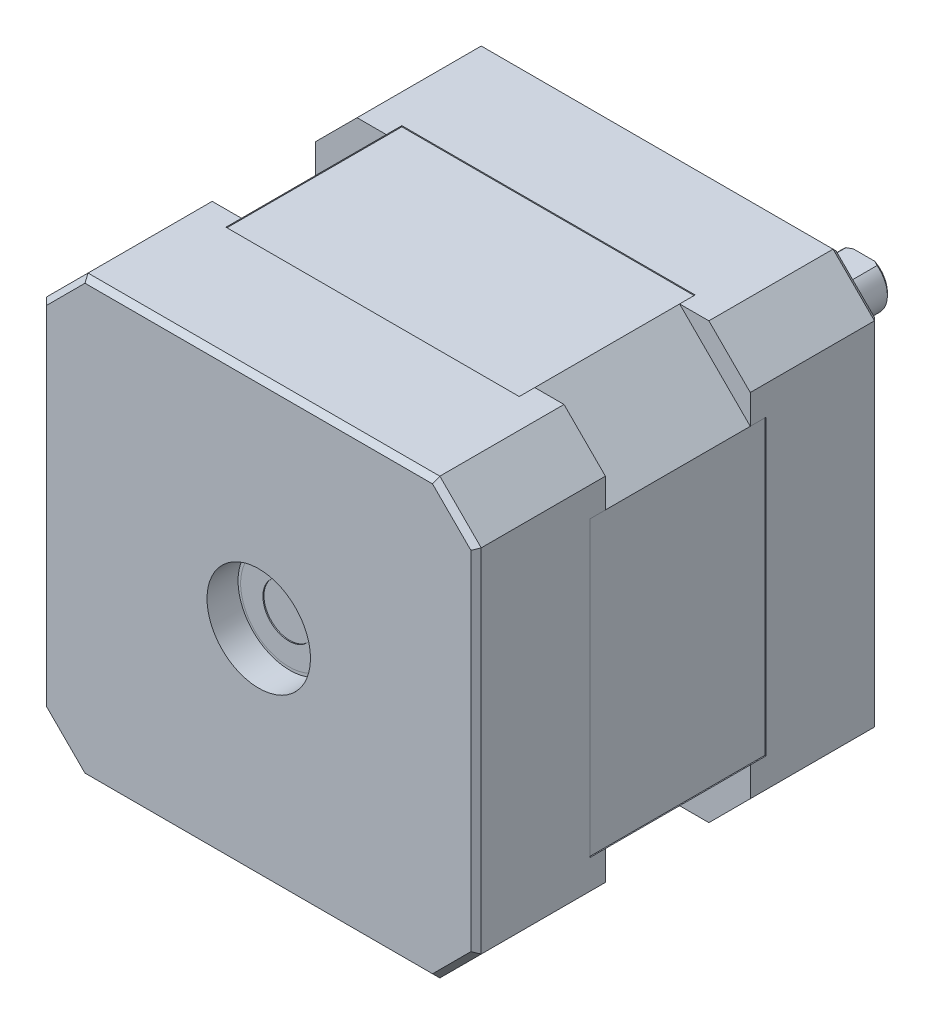
from build123d import *

# Parameters (mm, degrees)
CROQUIS1_W              = 42
CROQUIS1_H              = 42
SALIENTE_EXTRUIR1_DEPTH = 39
CHAFL_N2_SIZE           = 4
CHAFL_N3_SIZE           = 0.5
CROQUIS2_R              = 15
CORTAR_EXTRUIR2_DEPTH   = 0.5
CHAFL_N4_SIZE           = 1
CROQUIS3_R              = 11
CROQUIS3_R_2            = 4.75
SALIENTE_EXTRUIR2_DEPTH = 2.5
CROQUIS4_R              = 2.5
SALIENTE_EXTRUIR3_DEPTH = 20
CHAFL_N5_SIZE           = 0.25
CROQUIS5_W              = 26.553784045
CROQUIS5_H              = 10.322094095
CORTAR_EXTRUIR3_DEPTH   = 17.5
CROQUIS6_R              = 1.5
CORTAR_EXTRUIR4_DEPTH   = 12
MATRIZC1_COUNT          = 4
CROQUIS7_W              = 14
CROQUIS7_H              = 16.933623344
CORTAR_EXTRUIR5_DEPTH   = 2
MATRIZC2_COUNT          = 4
CORTAR_EXTRUIR6_DEPTH   = 0.1
MATRIZC3_COUNT          = 4
CROQUIS9_R              = 5
CORTAR_EXTRUIR7_DEPTH   = 3
SALIENTE_EXTRUIR4_START = 0.1
CROQUIS10_R             = 4.65
CROQUIS10_R_2           = 2.5
SALIENTE_EXTRUIR4_DEPTH = 0.1


with BuildPart() as part:
    # Croquis1 → Saliente-Extruir1 (new body)
    with BuildSketch(Plane.XY):
        Rectangle(CROQUIS1_W, CROQUIS1_H)
    extrude(amount=SALIENTE_EXTRUIR1_DEPTH)

    # Chaflán2
    chafl_n2_edges = [part.edges().sort_by_distance(p)[0] for p in [
        (21, -21, 19.5),
        (-21, -21, 19.5),
        (-21, 21, 19.5),
        (21, 21, 19.5),
    ]]
    chamfer(chafl_n2_edges, length=CHAFL_N2_SIZE)

    # Chaflán3
    chafl_n3_edges = [part.edges().sort_by_distance(p)[0] for p in [
        (21, 0, 0),
        (21, 0, 39),
        (0, -21, 0),
        (-21, 0, 0),
        (0, 21, 0),
        (-19, -19, 0),
        (-19, 19, 0),
        (19, 19, 0),
        (19, -19, 0),
        (0, -21, 39),
        (0, 21, 39),
        (-21, 0, 39),
        (-19, -19, 39),
        (-19, 19, 39),
        (19, 19, 39),
        (19, -19, 39),
    ]]
    chamfer(chafl_n3_edges, length=CHAFL_N3_SIZE)

    # Croquis2 → Cortar-Extruir2 (cut)
    with BuildSketch(Plane(origin=(0, 0, 0), x_dir=(-1, 0, 0), z_dir=(0, 0, -1))):
        Circle(CROQUIS2_R)
    extrude(amount=-CORTAR_EXTRUIR2_DEPTH, mode=Mode.SUBTRACT)

    # Chaflán4
    # the kernel refuses this chamfer: 1 mm, written as the material it adds along each edge
    with BuildSketch(Plane(origin=(0, 0, 0.5), x_dir=(-1, 0, 0), z_dir=(0, -1, 0))) as chafl_n4_piece_1_section:
        Polygon((15, CHAFL_N4_SIZE), (15 - CHAFL_N4_SIZE, 0), (15, 0), align=None)
    chafl_n4_piece_1 = revolve(axis=Axis((0, 0, 0.5), (0, 0, -1)), mode=Mode.PRIVATE)
    chafl_n4_piece_1 = split(chafl_n4_piece_1, bisect_by=Plane(origin=(14.259533629, 0, 0), z_dir=(0, 0, 1)), keep=Keep.TOP, mode=Mode.PRIVATE)
    add(chafl_n4_piece_1)

    # Croquis3 → Saliente-Extruir2 (add)
    with BuildSketch(Plane(origin=(0, 0, 0.5), x_dir=(-1, 0, 0), z_dir=(0, 0, -1))):
        Circle(CROQUIS3_R)
        Circle(CROQUIS3_R_2, mode=Mode.SUBTRACT)
    extrude(amount=SALIENTE_EXTRUIR2_DEPTH)

    # Croquis4 → Saliente-Extruir3 (add)
    with BuildSketch(Plane(origin=(0, 0, 0.5), x_dir=(-1, 0, 0), z_dir=(0, 0, -1))):
        Circle(CROQUIS4_R)
    extrude(amount=SALIENTE_EXTRUIR3_DEPTH)

    # Chaflán5
    chafl_n5_edges = [part.edges().sort_by_distance(p)[0] for p in [
        (2.5, 0, -19.5),
    ]]
    chamfer(chafl_n5_edges, length=CHAFL_N5_SIZE)

    # Croquis5 → Cortar-Extruir3 (cut)
    with BuildSketch(Plane(origin=(0, 0, -19.5), x_dir=(-1, 0, 0), z_dir=(0, 0, -1))):
        with Locations((-4.826169949, 7.161047048)):
            Rectangle(CROQUIS5_W, CROQUIS5_H)
    extrude(amount=-CORTAR_EXTRUIR3_DEPTH, mode=Mode.SUBTRACT)

    # Croquis6 → Cortar-Extruir4 (cut)
    with BuildSketch(Plane(origin=(0, 0, 0), x_dir=(-1, 0, 0), z_dir=(0, 0, -1))):
        with Locations((-15.35, 15.35)):
            Circle(CROQUIS6_R)
    cortar_extruir4 = extrude(amount=-CORTAR_EXTRUIR4_DEPTH, mode=Mode.SUBTRACT)

    # MatrizC1: Cortar-Extruir4 ×4 about axis
    matrizc1_axis = Axis((0, 0, 0), (0, 0, 1))
    for i in range(1, MATRIZC1_COUNT):
        add(cortar_extruir4.rotate(matrizc1_axis, i * 360 / MATRIZC1_COUNT), mode=Mode.SUBTRACT)

    # Croquis7 → Cortar-Extruir5 (cut)
    with BuildSketch(Plane(origin=(-19, -19, 0), x_dir=(0, 0, 1), z_dir=(-0.7071067811865487, -0.7071067811865465, 0))):
        with Locations((19.5, 0)):
            Rectangle(CROQUIS7_W, CROQUIS7_H)
    cortar_extruir5 = extrude(amount=-CORTAR_EXTRUIR5_DEPTH, mode=Mode.SUBTRACT)

    # MatrizC2: Cortar-Extruir5 ×4 about axis
    matrizc2_axis = Axis((0, 0, 0), (0, 0, 1))
    for i in range(1, MATRIZC2_COUNT):
        add(cortar_extruir5.rotate(matrizc2_axis, i * 360 / MATRIZC2_COUNT), mode=Mode.SUBTRACT)

    # Croquis8 → Cortar-Extruir6 (cut)
    with BuildSketch(Plane(origin=(0, 21, 0), x_dir=(1, 0, 0), z_dir=(0, 1, 0))):
        Polygon((-14.171572875, -12.5), (-14.171572875, -26.5), (-14.171572875, -28), (14.171572875, -28), (14.171572875, -26.5), (14.171572875, -12.5), (14.171572875, -11), (-14.171572875, -11), align=None)
    cortar_extruir6 = extrude(amount=-CORTAR_EXTRUIR6_DEPTH, mode=Mode.SUBTRACT)

    # MatrizC3: Cortar-Extruir6 ×4 about axis
    matrizc3_axis = Axis((0, 0, 0), (0, 0, 1))
    for i in range(1, MATRIZC3_COUNT):
        add(cortar_extruir6.rotate(matrizc3_axis, i * 360 / MATRIZC3_COUNT), mode=Mode.SUBTRACT)

    # Croquis9 → Cortar-Extruir7 (cut)
    with BuildSketch(Plane.XY.offset(39)):
        Circle(CROQUIS9_R)
    extrude(amount=-CORTAR_EXTRUIR7_DEPTH, mode=Mode.SUBTRACT)

    # Croquis10 → Saliente-Extruir4 (add)
    with BuildSketch(Plane.XY.offset(36).offset(SALIENTE_EXTRUIR4_START)):
        Circle(CROQUIS10_R)
        with Locations(Location((0, 0, 0), (0, 0, 53.130102354))):
            Circle(CROQUIS10_R_2, mode=Mode.SUBTRACT)
    extrude(amount=-SALIENTE_EXTRUIR4_DEPTH)


solid = part.part
